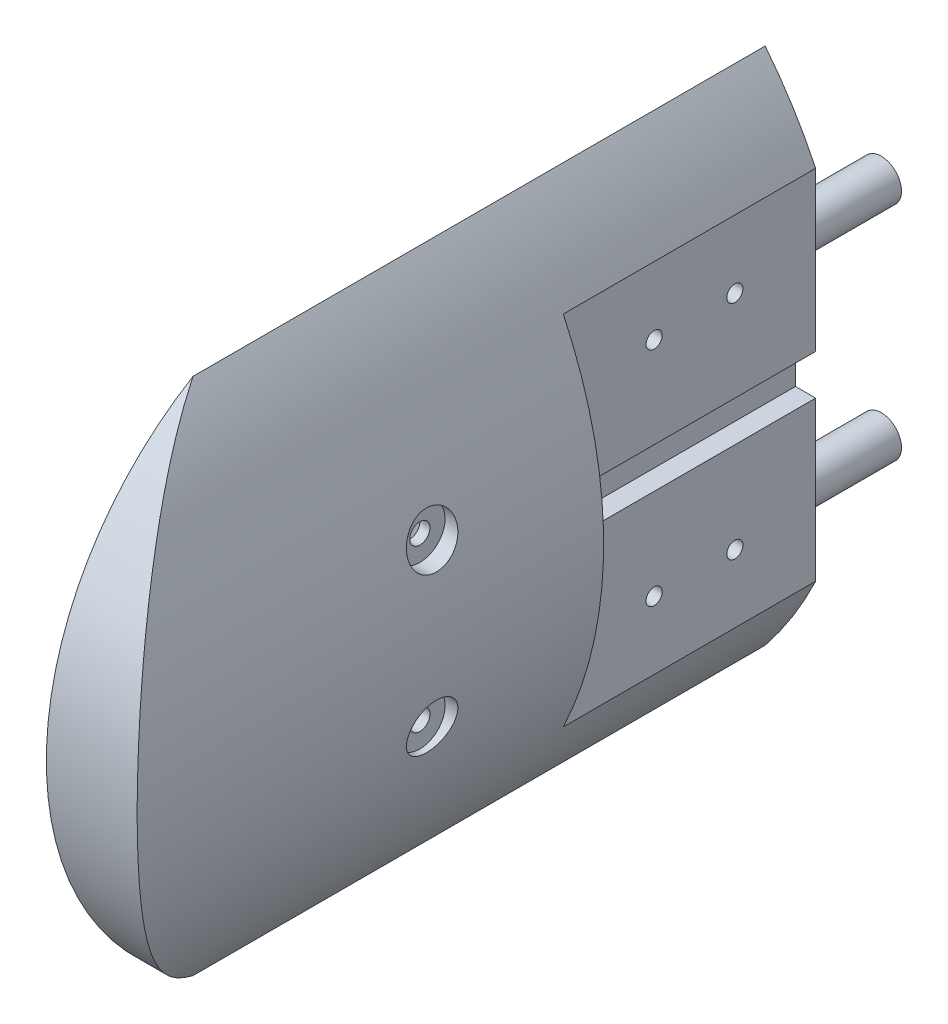
from build123d import *

# Parameters (mm, degrees)
SKETCH_1_W          = 9
SKETCH_1_H          = 60
EXTRUDE_1_DEPTH     = 41.2
SKETCH_4_R          = 30
EXTRUDE_3_DEPTH     = 9
CUT_EXTRUDE_1_DEPTH = 72
SKETCH_5_R          = 15.7
CUT_EXTRUDE_2_DEPTH = 3
SKETCH_6_W          = 4
SKETCH_6_H          = 28
CUT_EXTRUDE_3_DEPTH = 3
SKETCH_7_W          = 3
SKETCH_7_H          = 4
CUT_EXTRUDE_4_DEPTH = 39.2
SKETCH_8_W          = 4
SKETCH_8_H          = 82.4
CUT_EXTRUDE_5_DEPTH = 25
SKETCH_9_R          = 2
EXTRUDE_4_DEPTH     = 9
SKETCH_10_R         = 0.8
CUT_EXTRUDE_6_DEPTH = 5
SKETCH_11_R         = 1
CUT_EXTRUDE_7_DEPTH = 1
SKETCH_12_R         = 2.5
CUT_EXTRUDE_9_DEPTH = 2


with BuildPart() as part:
    # 草图1 → 凸台-拉伸1 (new body)
    with BuildSketch(Plane.XY):
        with Locations((36.7, 0)):
            Rectangle(SKETCH_1_W, SKETCH_1_H)
    extrude(amount=EXTRUDE_1_DEPTH)

    # 草图4 → 凸台-拉伸3 (add)
    with BuildSketch(Plane.ZY.offset(-32.2)):
        with Locations((41.2, 0)):
            Circle(SKETCH_4_R)
    extrude(amount=-EXTRUDE_3_DEPTH)

    # 切除-拉伸1: read off the stored shape, not the designer's step
    # 切除-拉伸1 outline → 切除-拉伸1 (cut)
    with BuildSketch(Plane.XY):
        with BuildLine():
            Line((32.2, 30), (32.2, 25.702139989))
            ThreePointArc((32.2, 25.702139989), (38.884958532, 13.616166862), (41.2, 0))
            Line((41.2, 0), (41.2, 30))
            Line((41.2, 30), (32.2, 30))
        make_face()
        with BuildLine():
            Line((41.2, -30), (41.2, 0))
            ThreePointArc((41.2, 0), (38.884958532, -13.616166862), (32.2, -25.702139989))
            Line((32.2, -25.702139989), (32.2, -30))
            Line((32.2, -30), (41.2, -30))
        make_face()
    extrude(amount=CUT_EXTRUDE_1_DEPTH, mode=Mode.SUBTRACT)

    # 草图5 → 切除-拉伸2 (cut)
    with BuildSketch(Plane.ZY.offset(-32.2)):
        with Locations((41.2, 0)):
            Circle(SKETCH_5_R)
    extrude(amount=-CUT_EXTRUDE_2_DEPTH, mode=Mode.SUBTRACT)

    # 草图6 → 切除-拉伸3 (cut)
    with BuildSketch(Plane.ZY.offset(-35.2)):
        with Locations((41.2, 0)):
            Rectangle(SKETCH_6_W, SKETCH_6_H)
    extrude(amount=-CUT_EXTRUDE_3_DEPTH, mode=Mode.SUBTRACT)

    # 草图7 → 切除-拉伸4 (cut)
    with BuildSketch(Plane.XY.offset(39.2)):
        with Locations((36.7, 0)):
            Rectangle(SKETCH_7_W, SKETCH_7_H)
    extrude(amount=-CUT_EXTRUDE_4_DEPTH, mode=Mode.SUBTRACT)

    # 草图8 → 切除-拉伸5 (cut)
    with BuildSketch(Plane.XY):
        with Locations((39.2, 0)):
            Rectangle(SKETCH_8_W, SKETCH_8_H)
    extrude(amount=CUT_EXTRUDE_5_DEPTH, mode=Mode.SUBTRACT)

    # 草图9 → 凸台-拉伸4 (add)
    with BuildSketch(Plane.XY):
        with Locations((34.7, 11)):
            Circle(SKETCH_9_R)
        with Locations((34.7, -11)):
            Circle(SKETCH_9_R)
    extrude(amount=-EXTRUDE_4_DEPTH)

    # 草图10 → 切除-拉伸6 (cut)
    with BuildSketch(Plane(origin=(37.2, 0, 0), x_dir=(0, 0, -1), z_dir=(1, 0, 0))):
        with Locations((-16, -11)):
            Circle(SKETCH_10_R)
        with Locations((-8, -11)):
            Circle(SKETCH_10_R)
        with Locations((-16, 11)):
            Circle(SKETCH_10_R)
        with Locations((-8, 11)):
            Circle(SKETCH_10_R)
    extrude(amount=-CUT_EXTRUDE_6_DEPTH, mode=Mode.SUBTRACT)

    # 草图11 → 切除-拉伸7 (cut)
    with BuildSketch(Plane.ZY.offset(-38.2)):
        with Locations((41.2, 8)):
            Circle(SKETCH_11_R)
        with Locations((41.2, -8)):
            Circle(SKETCH_11_R)
    extrude(amount=-CUT_EXTRUDE_7_DEPTH, mode=Mode.SUBTRACT)

    # 草图12 → 切除-拉伸9 (cut)
    with BuildSketch(Plane.ZY.offset(-39.2)):
        with Locations((41.2, 8)):
            Circle(SKETCH_12_R)
        with Locations((41.2, -8)):
            Circle(SKETCH_12_R)
    extrude(amount=-CUT_EXTRUDE_9_DEPTH, mode=Mode.SUBTRACT)


solid = part.part
